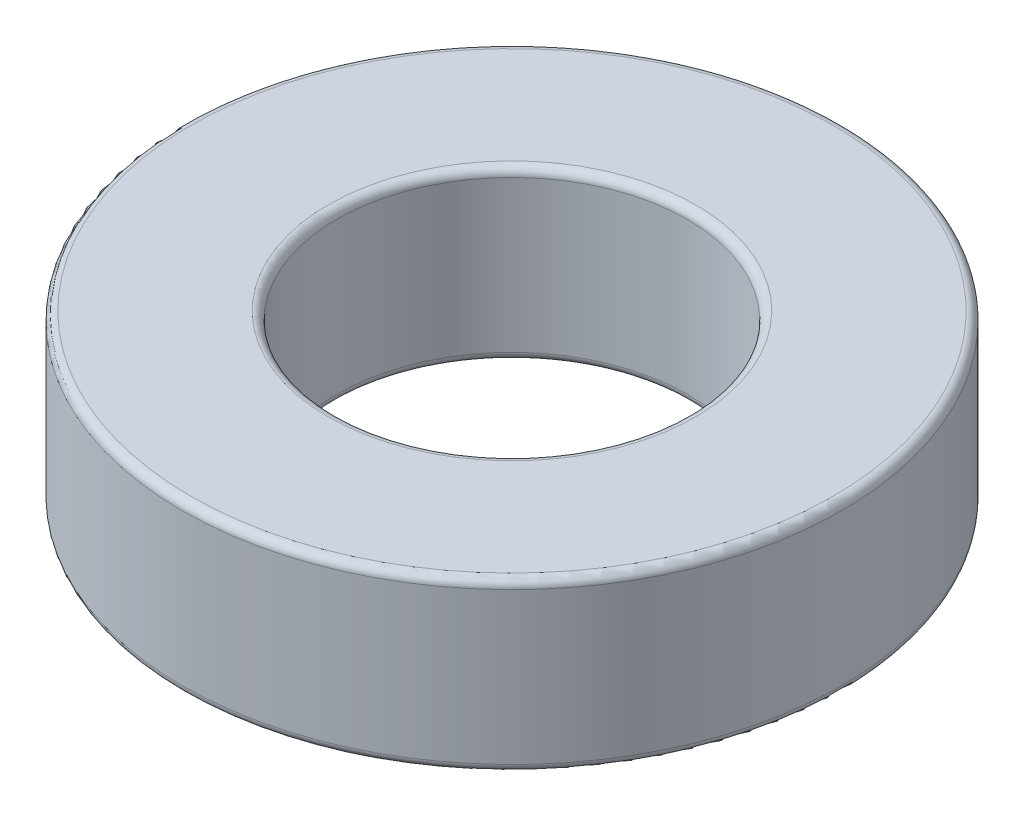
from build123d import *

# Parameters (mm, degrees)
SKETCH1_R           = 23.5
SKETCH1_R_2         = 12.5
BOSS_EXTRUDE1_DEPTH = 12
FILLET1_R           = 0.6


with BuildPart() as part:
    # Sketch1 → Boss-Extrude1 (new body)
    with BuildSketch(Plane(origin=(0, 0, 0), x_dir=(1, 0, 0), z_dir=(0, 1, 0))):
        Circle(SKETCH1_R)
        Circle(SKETCH1_R_2, mode=Mode.SUBTRACT)
    extrude(amount=BOSS_EXTRUDE1_DEPTH)

    # Fillet1
    fillet1_edges = [part.edges().sort_by_distance(p)[0] for p in [
        (-12.5, 0, 0),
        (-23.5, 0, 0),
        (-12.5, 12, 0),
        (-23.5, 12, 0),
    ]]
    fillet(fillet1_edges, radius=FILLET1_R)


solid = part.part
